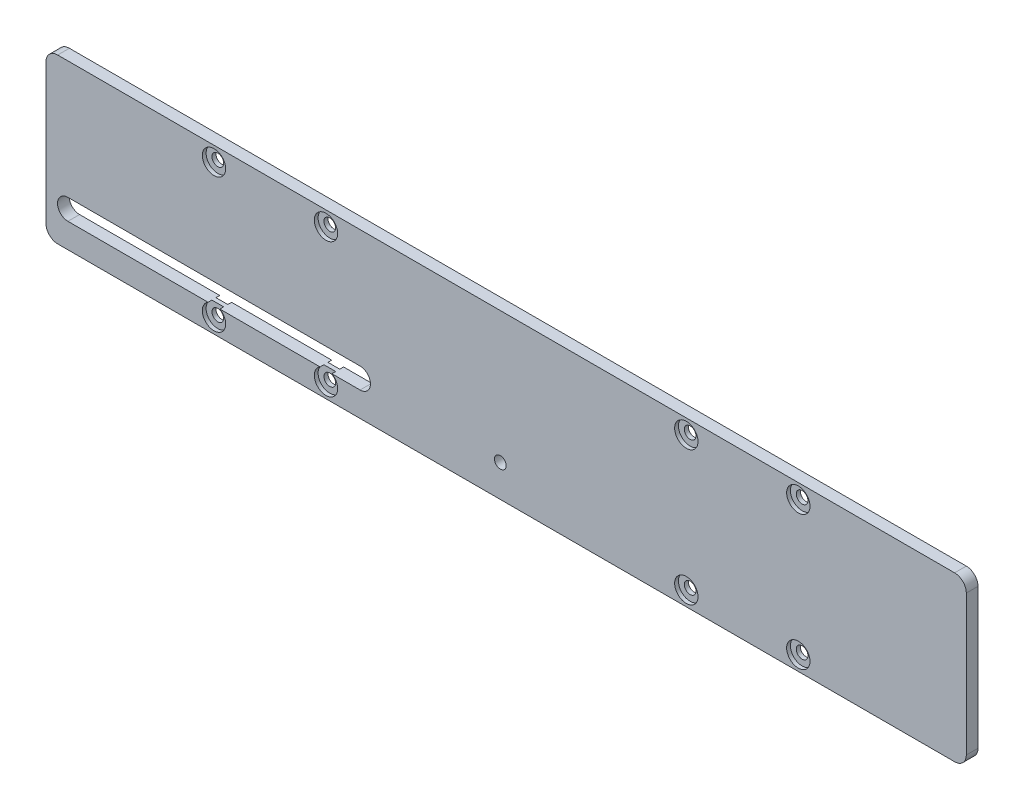
from build123d import *

# Parameters (mm, degrees)
SKETCH_1_R          = 2
EXTRUDE_1_DEPTH     = 4
SKETCH_2_R          = 4
CUT_EXTRUDE_1_DEPTH = 1.3
SKETCH_3_R          = 2
CUT_EXTRUDE_2_DEPTH = 10
CUT_EXTRUDE_START   = -1.3
SKETCH_5_R          = 4
CUT_EXTRUDE_4_DEPTH = 1.3


with BuildPart() as part:
    # 草图1 → 凸台-拉伸1 (new body)
    with BuildSketch(Plane.XY):
        with BuildLine():
            Line((153.5, -28), (-153.5, -28))
            ThreePointArc((-153.5, -28), (-156.328427125, -26.828427125), (-157.5, -24))
            Line((-157.5, -24), (-157.5, 24))
            ThreePointArc((-157.5, 24), (-156.328427125, 26.828427125), (-153.5, 28))
            Line((-153.5, 28), (153.5, 28))
            ThreePointArc((153.5, 28), (156.328427125, 26.828427125), (157.5, 24))
            Line((157.5, 24), (157.5, -24))
            ThreePointArc((157.5, -24), (156.328427125, -26.828427125), (153.5, -28))
        make_face()
        with Locations((-100, 23)):
            Circle(SKETCH_1_R, mode=Mode.SUBTRACT)
        with Locations((-61.67, 23)):
            Circle(SKETCH_1_R, mode=Mode.SUBTRACT)
        with Locations((-100, -23)):
            Circle(SKETCH_1_R, mode=Mode.SUBTRACT)
        with Locations((-61.67, -23)):
            Circle(SKETCH_1_R, mode=Mode.SUBTRACT)
        with Locations((100, -23)):
            Circle(SKETCH_1_R, mode=Mode.SUBTRACT)
        with Locations((61.67, -23)):
            Circle(SKETCH_1_R, mode=Mode.SUBTRACT)
        with Locations((61.67, 23)):
            Circle(SKETCH_1_R, mode=Mode.SUBTRACT)
        with Locations((100, 23)):
            Circle(SKETCH_1_R, mode=Mode.SUBTRACT)
        with BuildLine():
            Line((-150, -12.45), (-50, -12.45))
            ThreePointArc((-50, -12.45), (-46.45, -16), (-50, -19.55))
            Line((-50, -19.55), (-150, -19.55))
            ThreePointArc((-150, -19.55), (-153.55, -16), (-150, -12.45))
        make_face(mode=Mode.SUBTRACT)
    extrude(amount=EXTRUDE_1_DEPTH)

    # 草图2 → 切除-拉伸1 (cut)
    with BuildSketch(Plane.XY.offset(4)):
        with Locations((-100, 23)):
            Circle(SKETCH_2_R)
        with Locations((-61.67, 23)):
            Circle(SKETCH_2_R)
        with Locations((-100, -23)):
            Circle(SKETCH_2_R)
        with Locations((-61.67, -23)):
            Circle(SKETCH_2_R)
        with Locations((61.67, -23)):
            Circle(SKETCH_2_R)
        with Locations((100, -23)):
            Circle(SKETCH_2_R)
        with Locations((61.67, 23)):
            Circle(SKETCH_2_R)
        with Locations((100, 23)):
            Circle(SKETCH_2_R)
    extrude(amount=-CUT_EXTRUDE_1_DEPTH, mode=Mode.SUBTRACT)

    # 草图3 → 切除-拉伸2 (cut)
    with BuildSketch(Plane.XY.offset(4)):
        with Locations((-2, -17)):
            Circle(SKETCH_3_R)
    extrude(amount=-CUT_EXTRUDE_2_DEPTH, mode=Mode.SUBTRACT)

    # 草图5 → 切除-拉伸4 (cut)
    with BuildSketch(Plane(origin=(0, 0, 0), x_dir=(-1, 0, 0), z_dir=(0, 0, -1)).offset(CUT_EXTRUDE_START)):
        with Locations((-100, -23)):
            Circle(SKETCH_5_R)
        with Locations((-61.67, -23)):
            Circle(SKETCH_5_R)
        with Locations((61.67, -23)):
            Circle(SKETCH_5_R)
        with Locations((100, -23)):
            Circle(SKETCH_5_R)
        with Locations((100, 23)):
            Circle(SKETCH_5_R)
        with Locations((61.67, 23)):
            Circle(SKETCH_5_R)
        with Locations((-61.67, 23)):
            Circle(SKETCH_5_R)
        with Locations((-100, 23)):
            Circle(SKETCH_5_R)
    extrude(amount=CUT_EXTRUDE_4_DEPTH, mode=Mode.SUBTRACT)


solid = part.part
